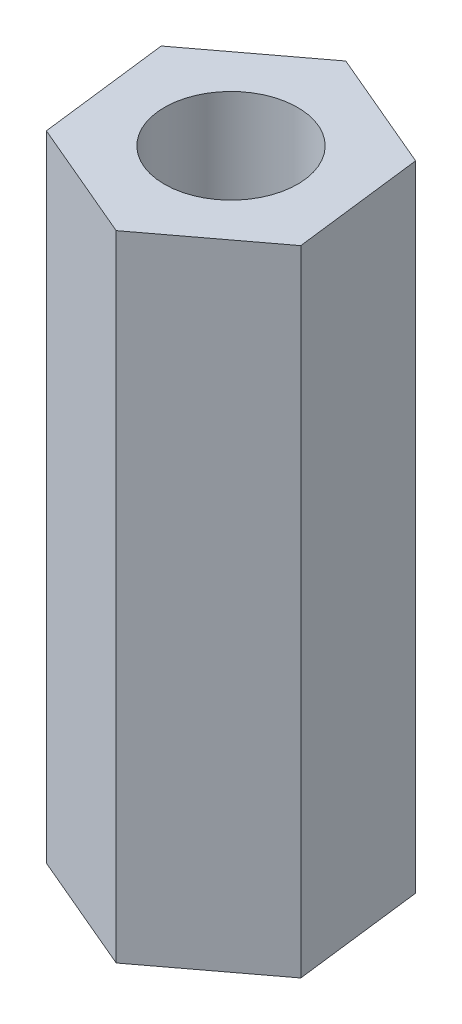
from build123d import *

# Parameters (mm, degrees)
SKETCH_1_R      = 2.1
EXTRUDE_1_DEPTH = 20


with BuildPart() as part:
    # 草图1 → 凸台-拉伸1 (new body)
    with BuildSketch(Plane(origin=(0, 0, 0), x_dir=(1, 0, 0), z_dir=(0, 1, 0))):
        Polygon((3.320611657, 2.500707544), (-0.505370432, 4.126087823), (-3.825982089, 1.625380279), (-3.320611657, -2.500707544), (0.505370432, -4.126087823), (3.825982089, -1.625380279), align=None)
        Circle(SKETCH_1_R, mode=Mode.SUBTRACT)
    extrude(amount=EXTRUDE_1_DEPTH)


solid = part.part
